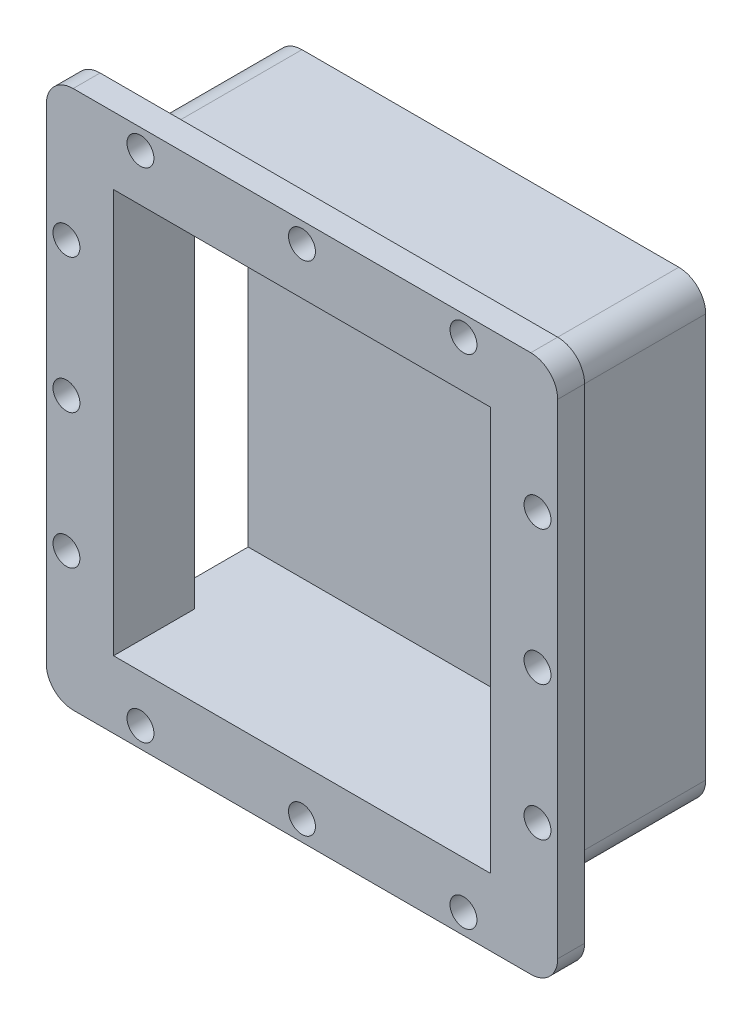
from build123d import *

# Parameters (mm, degrees)
EXTRUDE_1_DEPTH          = 60
CUT_EXTRUDE_2_DEPTH      = 191.85334684
CUT_EXTRUDE_2_DEPTH_BACK = 150
SKETCH_5_W               = 30
SKETCH_5_H               = 150
SKETCH_7_R               = 5
EXTRUDE_2_DEPTH          = 10
SKETCH_8_W               = 140
SKETCH_8_H               = 150
CUT_EXTRUDE_4_DEPTH      = 40


with BuildPart() as part:
    # 草图1 → 凸台-拉伸1 (new body)
    with BuildSketch(Plane.XY):
        with BuildLine():
            Line((-70, -85), (70, -85))
            ThreePointArc((70, -85), (77.071067812, -82.071067812), (80, -75))
            Line((80, -75), (80, 75))
            ThreePointArc((80, 75), (77.071067812, 82.071067812), (70, 85))
            Line((70, 85), (-70, 85))
            ThreePointArc((-70, 85), (-77.071067812, 82.071067812), (-80, 75))
            Line((-80, 75), (-80, -75))
            ThreePointArc((-80, -75), (-77.071067812, -82.071067812), (-70, -85))
        make_face()
    extrude(amount=EXTRUDE_1_DEPTH)

    # 草图5 → 切除-拉伸2 (cut, two sides: drawn at the far end of the back side and taken through both)
    with BuildSketch(Plane.ZY.offset(80).offset(-CUT_EXTRUDE_2_DEPTH_BACK)):
        with Locations((25, 0)):
            Rectangle(SKETCH_5_W, SKETCH_5_H)
    extrude(amount=CUT_EXTRUDE_2_DEPTH + CUT_EXTRUDE_2_DEPTH_BACK, mode=Mode.SUBTRACT)

    # 草图7 → 凸台-拉伸2 (add)
    with BuildSketch(Plane.XY.offset(60)):
        with BuildLine():
            Line((-85, -100), (85, -100))
            ThreePointArc((85, -100), (92.071067812, -97.071067812), (95, -90))
            Line((95, -90), (95, 90))
            ThreePointArc((95, 90), (92.071067812, 97.071067812), (85, 100))
            Line((85, 100), (-85, 100))
            ThreePointArc((-85, 100), (-92.071067812, 97.071067812), (-95, 90))
            Line((-95, 90), (-95, -90))
            ThreePointArc((-95, -90), (-92.071067812, -97.071067812), (-85, -100))
        make_face()
        with Locations((0, 92.5)):
            Circle(SKETCH_7_R, mode=Mode.SUBTRACT)
        with Locations((-60, 92.5)):
            Circle(SKETCH_7_R, mode=Mode.SUBTRACT)
        with Locations((-87.5, 0)):
            Circle(SKETCH_7_R, mode=Mode.SUBTRACT)
        with Locations((-87.5, 50)):
            Circle(SKETCH_7_R, mode=Mode.SUBTRACT)
        with Locations((87.5, 0)):
            Circle(SKETCH_7_R, mode=Mode.SUBTRACT)
        with Locations((87.5, 50)):
            Circle(SKETCH_7_R, mode=Mode.SUBTRACT)
        with Locations((60, 92.5)):
            Circle(SKETCH_7_R, mode=Mode.SUBTRACT)
        with Locations((-87.5, -50)):
            Circle(SKETCH_7_R, mode=Mode.SUBTRACT)
        with Locations((87.5, -50)):
            Circle(SKETCH_7_R, mode=Mode.SUBTRACT)
        with Locations((60, -92.5)):
            Circle(SKETCH_7_R, mode=Mode.SUBTRACT)
        with Locations((0, -92.5)):
            Circle(SKETCH_7_R, mode=Mode.SUBTRACT)
        with Locations((-60, -92.5)):
            Circle(SKETCH_7_R, mode=Mode.SUBTRACT)
    extrude(amount=EXTRUDE_2_DEPTH)

    # 草图8 → 切除-拉伸4 (cut)
    with BuildSketch(Plane.XY.offset(70)):
        Rectangle(SKETCH_8_W, SKETCH_8_H)
    extrude(amount=-CUT_EXTRUDE_4_DEPTH, mode=Mode.SUBTRACT)


solid = part.part
